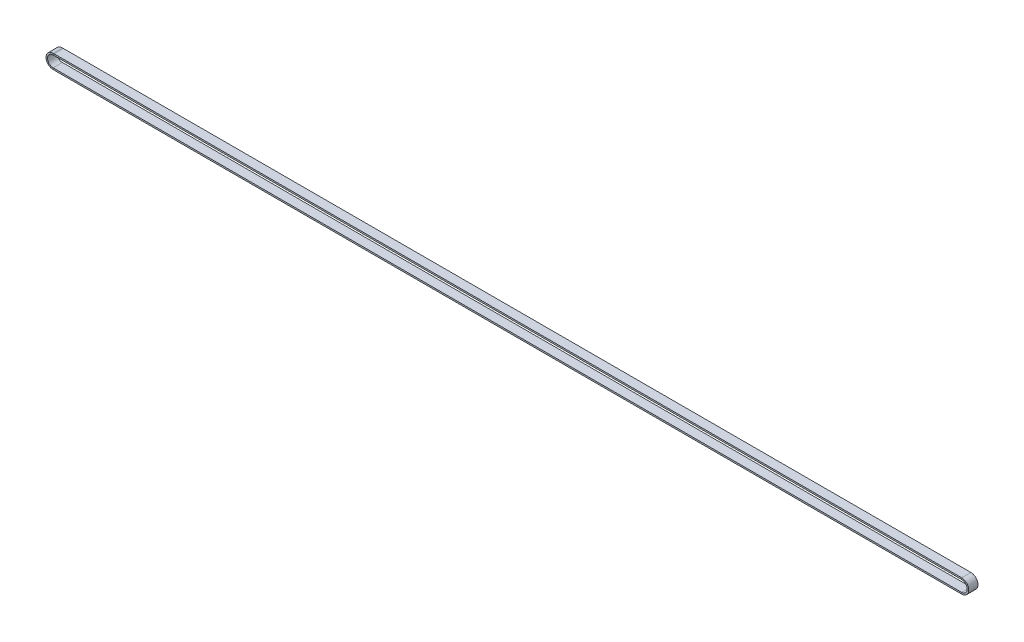
from build123d import *

# Parameters (mm, degrees)
SKETCH3_W = 9
SKETCH3_H = 1.5


with BuildPart() as part:
    # Sweep1: sweep along a path in Sketch2
    with BuildLine(Plane.XY.offset(-48.483366658)) as sweep1_path:
        Line((-1, -56.844571316), (883.520637828, -56.844571316))
        ThreePointArc((883.520637828, -56.844571316), (890.420637828, -63.744571316), (883.520637828, -70.644571316))
        Line((883.520637828, -70.644571316), (-1, -70.644571316))
        ThreePointArc((-1, -70.644571316), (-7.9, -63.744571316), (-1, -56.844571316))
    # Sketch3 → Sweep1 (sweep)
    with BuildSketch(Plane(origin=(0, 0, 0), x_dir=(0, 0, -1), z_dir=(1, 0, 0))):
        with Locations((43.983366658, -57.594571316)):
            Rectangle(SKETCH3_W, SKETCH3_H)
    sweep(path=sweep1_path.line)


solid = part.part
